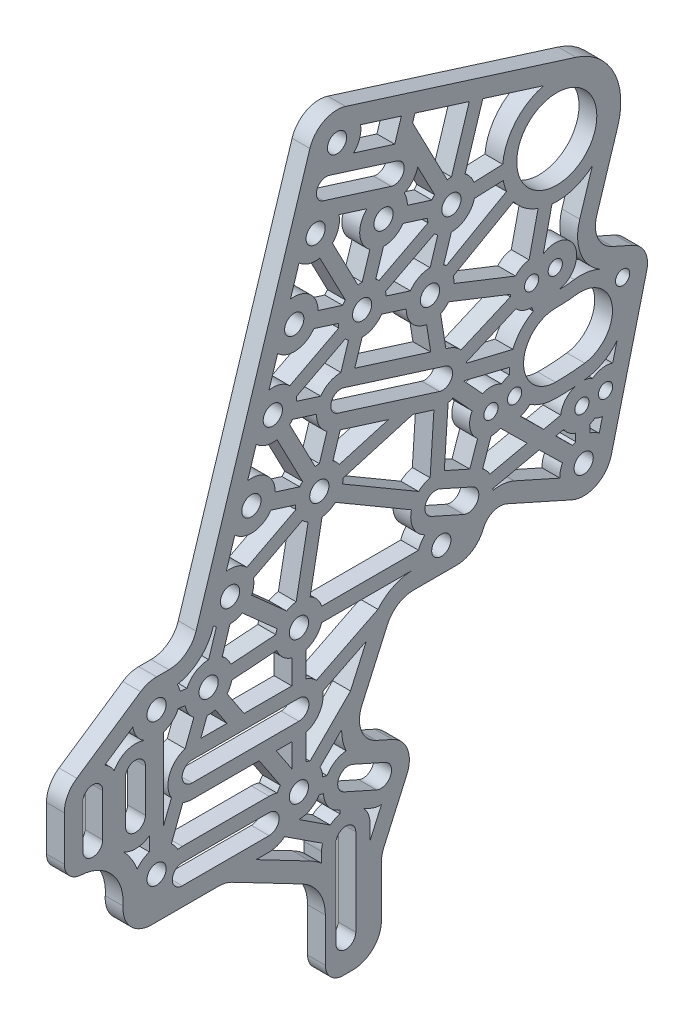
from build123d import *

# Parameters (mm, degrees)
BOSS_EXTRUDE1_DEPTH      = 3.175
BOSS_EXTRUDE1_DEPTH_BACK = 3.175
SKETCH2_R                = 14.2875
SKETCH2_R_2              = 3.429
SKETCH2_R_3              = 2.54
CUT_EXTRUDE2_DEPTH       = 287.611673302


with BuildPart() as part:
    # Sketch2 → Boss-Extrude1 (new, two sides: drawn at the far end of the back side and taken through both)
    with BuildSketch(Plane(origin=(0, 0, 0), x_dir=(0, 0, -1), z_dir=(1, 0, 0)).offset(-BOSS_EXTRUDE1_DEPTH_BACK)):
        with BuildLine():
            Line((38.021448917, 246.234864084), (120.241230069, 220.311066665))
            ThreePointArc((120.241230069, 220.311066665), (133.644163138, 209.06467047), (135.169064986, 191.634962595))
            Line((135.169064986, 191.634962595), (127.622152065, 167.6992128))
            ThreePointArc((127.622152065, 167.6992128), (128.044603019, 160.47960856), (133.162508812, 155.36999111))
            Line((133.162508812, 155.36999111), (140.48887895, 152.092017357))
            ThreePointArc((140.48887895, 152.092017357), (144.852236282, 147.866521475), (145.483799346, 141.825426314))
            Line((145.483799346, 141.825426314), (132.821367632, 91.06703794))
            ThreePointArc((132.821367632, 91.06703794), (127.408392323, 84.390132513), (118.814072234, 84.252183312))
            Line((118.814072234, 84.252183312), (95.644233558, 94.61886171))
            ThreePointArc((95.644233558, 94.61886171), (90.786060122, 94.754966448), (87.254572158, 91.415959651))
            Line((87.254572158, 91.415959651), (86.910445683, 90.646826606))
            ThreePointArc((86.910445683, 90.646826606), (83.162135594, 86.27028604), (77.636394916, 84.636234079))
            Line((77.636394916, 84.636234079), (62.21871433, 84.636234079))
            ThreePointArc((62.21871433, 84.636234079), (56.692973652, 83.002182118), (52.944663563, 78.625641552))
            Line((52.944663563, 78.625641552), (43.839685496, 58.275741142))
            ThreePointArc((43.839685496, 58.275741142), (43.621917914, 50.502663645), (48.96432879, 44.852282903))
            Line((48.96432879, 44.852282903), (54.760610519, 42.258903232))
            ThreePointArc((54.760610519, 42.258903232), (60.103021394, 36.60852249), (59.885253813, 28.835444993))
            Line((59.885253813, 28.835444993), (51.685949233, 10.509752126))
            ThreePointArc((51.685949233, 10.509752126), (51.023955621, 8.481811623), (50.8, 6.360344653))
            Line((50.8, 6.360344653), (50.8, -11.7475))
            ThreePointArc((50.8, -11.7475), (47.824204897, -18.931704897), (40.64, -21.9075))
            Line((40.64, -21.9075), (37.1475, -21.9075))
            ThreePointArc((37.1475, -21.9075), (32.657371939, -20.047628061), (30.7975, -15.5575))
            Line((30.7975, -15.5575), (30.7975, 0))
            ThreePointArc((30.7975, 0), (28.552596998, 8.032774411), (22.468409419, 13.737834946))
            Line((22.468409419, 13.737834946), (-2.554479623, 26.788416358))
            ThreePointArc((-2.554479623, 26.788416358), (-4.834094275, 27.647905305), (-7.252780881, 27.94))
            Line((-7.252780881, 27.94), (-31.256978796, 27.94))
            ThreePointArc((-31.256978796, 27.94), (-38.707276299, 31.19213006), (-41.38801938, 38.866561592))
            ThreePointArc((-41.38801938, 38.866561592), (-45.28789684, 50.537792221), (-56.355984579, 55.915905494))
            ThreePointArc((-56.355984579, 55.915905494), (-60.621662669, 57.889989399), (-62.361270294, 62.25654206))
            Line((-62.361270294, 62.25654206), (-62.361270294, 78.164314079))
            ThreePointArc((-62.361270294, 78.164314079), (-61.17251471, 82.933210558), (-57.884425091, 86.586151856))
            Line((-57.884425091, 86.586151856), (-35.119675091, 101.948071856))
            ThreePointArc((-35.119675091, 101.948071856), (-32.408029017, 103.24198088), (-29.436520294, 103.686234079))
            Line((-29.436520294, 103.686234079), (-25.026637608, 103.686234079))
            ThreePointArc((-25.026637608, 103.686234079), (-19.01893158, 105.6527569), (-15.336873388, 110.791063156))
            Line((-15.336873388, 110.791063156), (25.276513775, 239.600270788))
            ThreePointArc((25.276513775, 239.600270788), (30.274912084, 245.55712993), (38.021448917, 246.234864084))
        make_face()
        with Locations((113.367095492, 198.509097171)):
            Circle(SKETCH2_R, mode=Mode.SUBTRACT)
        with Locations((-29.436520294, 42.726234079)):
            Circle(SKETCH2_R_2, mode=Mode.SUBTRACT)
        with Locations((21.363479706, 93.526234079)):
            Circle(SKETCH2_R_2, mode=Mode.SUBTRACT)
        with Locations((122.963479706, 93.526234079)):
            Circle(SKETCH2_R_2, mode=Mode.SUBTRACT)
        with Locations((104.398969727, 158.50014909)):
            Circle(SKETCH2_R_3, mode=Mode.SUBTRACT)
        with Locations((136.858147411, 143.977222936)):
            Circle(SKETCH2_R_3, mode=Mode.SUBTRACT)
        with Locations((122.335221257, 111.518045252)):
            Circle(SKETCH2_R_3, mode=Mode.SUBTRACT)
        with Locations((89.876043573, 126.040971407)):
            Circle(SKETCH2_R_3, mode=Mode.SUBTRACT)
        with Locations((112.840572264, 159.063757816)):
            Circle(SKETCH2_R_3, mode=Mode.SUBTRACT)
        with Locations((130.776823793, 112.081653978)):
            Circle(SKETCH2_R_3, mode=Mode.SUBTRACT)
        with Locations((98.317646109, 126.604580132)):
            Circle(SKETCH2_R_3, mode=Mode.SUBTRACT)
        with Locations((-29.436520294, 93.526234079)):
            Circle(SKETCH2_R_2, mode=Mode.SUBTRACT)
        with Locations((21.363479706, 42.726234079)):
            Circle(SKETCH2_R_2, mode=Mode.SUBTRACT)
        with Locations((72.163479706, 93.526234079)):
            Circle(SKETCH2_R_2, mode=Mode.SUBTRACT)
        with Locations((34.966277994, 236.545099865)):
            Circle(SKETCH2_R_2, mode=Mode.SUBTRACT)
        with Locations((27.328350687, 212.320689316)):
            Circle(SKETCH2_R_2, mode=Mode.SUBTRACT)
        with Locations((19.690423379, 188.096278767)):
            Circle(SKETCH2_R_2, mode=Mode.SUBTRACT)
        with Locations((12.052496072, 163.871868218)):
            Circle(SKETCH2_R_2, mode=Mode.SUBTRACT)
        with Locations((4.414568765, 139.647457669)):
            Circle(SKETCH2_R_2, mode=Mode.SUBTRACT)
        with Locations((-3.223358543, 115.42304712)):
            Circle(SKETCH2_R_2, mode=Mode.SUBTRACT)
        with Locations((-10.86128585, 91.198636571)):
            Circle(SKETCH2_R_2, mode=Mode.SUBTRACT)
        with Locations((51.552761236, 204.682762008)):
            Circle(SKETCH2_R_2, mode=Mode.SUBTRACT)
        with Locations((43.914833928, 180.458351459)):
            Circle(SKETCH2_R_2, mode=Mode.SUBTRACT)
        with Locations((75.777171785, 197.044834701)):
            Circle(SKETCH2_R_2, mode=Mode.SUBTRACT)
        with Locations((68.139244477, 172.820424152)):
            Circle(SKETCH2_R_2, mode=Mode.SUBTRACT)
        with Locations((28.638979314, 132.009530361)):
            Circle(SKETCH2_R_2, mode=Mode.SUBTRACT)
        with BuildLine():
            Line((30.078004517, 221.041477113), (54.302415066, 213.403549806))
            ThreePointArc((54.302415066, 213.403549806), (58.763142366, 215.72565746), (56.441034713, 220.18638476))
            Line((56.441034713, 220.18638476), (32.216624164, 227.824312067))
            ThreePointArc((32.216624164, 227.824312067), (27.755896864, 225.502204413), (30.078004517, 221.041477113))
        make_face(mode=Mode.SUBTRACT)
        with BuildLine():
            Line((41.656, 20.2565), (41.656, -10.7315))
            ThreePointArc((41.656, -10.7315), (38.1, -14.2875), (34.544, -10.7315))
            Line((34.544, -10.7315), (34.544, 20.2565))
            ThreePointArc((34.544, 20.2565), (38.1, 23.8125), (41.656, 20.2565))
        make_face(mode=Mode.SUBTRACT)
        with BuildLine():
            Line((-20.2565, 41.656), (10.7315, 41.656))
            ThreePointArc((10.7315, 41.656), (14.2875, 38.1), (10.7315, 34.544))
            Line((10.7315, 34.544), (-20.2565, 34.544))
            ThreePointArc((-20.2565, 34.544), (-23.8125, 38.1), (-20.2565, 41.656))
        make_face(mode=Mode.SUBTRACT)
        with BuildLine():
            Line((-48.645270294, 78.164314079), (-48.645270294, 62.924314079))
            ThreePointArc((-48.645270294, 62.924314079), (-52.201270294, 59.368314079), (-55.757270294, 62.924314079))
            Line((-55.757270294, 62.924314079), (-55.757270294, 78.164314079))
            ThreePointArc((-55.757270294, 78.164314079), (-52.201270294, 81.720314079), (-48.645270294, 78.164314079))
        make_face(mode=Mode.SUBTRACT)
        with BuildLine():
            Line((-33.405270294, 78.164314079), (-33.405270294, 62.924314079))
            ThreePointArc((-33.405270294, 62.924314079), (-36.961270294, 59.368314079), (-40.517270294, 62.924314079))
            Line((-40.517270294, 62.924314079), (-40.517270294, 78.164314079))
            ThreePointArc((-40.517270294, 78.164314079), (-36.961270294, 81.720314079), (-33.405270294, 78.164314079))
        make_face(mode=Mode.SUBTRACT)
        with BuildLine():
            Line((37.346216444, 159.625358387), (73.682832268, 148.168467426))
            ThreePointArc((73.682832268, 148.168467426), (76.004939921, 143.707740126), (71.544212621, 141.385632472))
            Line((71.544212621, 141.385632472), (35.207596798, 152.842523433))
            ThreePointArc((35.207596798, 152.842523433), (32.885489144, 157.303250733), (37.346216444, 159.625358387))
        make_face(mode=Mode.SUBTRACT)
        with BuildLine():
            Line((-16.736520294, 71.682234079), (21.363479706, 71.682234079))
            ThreePointArc((21.363479706, 71.682234079), (24.919479706, 68.126234079), (21.363479706, 64.570234079))
            Line((21.363479706, 64.570234079), (-16.736520294, 64.570234079))
            ThreePointArc((-16.736520294, 64.570234079), (-20.292520294, 68.126234079), (-16.736520294, 71.682234079))
        make_face(mode=Mode.SUBTRACT)
        with BuildLine():
            Line((71.695223435, 111.204761595), (83.287786894, 106.018002254))
            ThreePointArc((83.287786894, 106.018002254), (85.209528129, 100.984205414), (80.175731289, 99.062464179))
            Line((80.175731289, 99.062464179), (68.583167831, 104.24922352))
            ThreePointArc((68.583167831, 104.24922352), (66.661426596, 109.28302036), (71.695223435, 111.204761595))
        make_face(mode=Mode.SUBTRACT)
        with BuildLine():
            Line((40.57466739, 41.649380844), (52.167230848, 36.462621503))
            ThreePointArc((52.167230848, 36.462621503), (54.088972084, 31.428824663), (49.055175244, 29.507083428))
            Line((49.055175244, 29.507083428), (37.462611785, 34.693842769))
            ThreePointArc((37.462611785, 34.693842769), (35.54087055, 39.727639609), (40.57466739, 41.649380844))
        make_face(mode=Mode.SUBTRACT)
        with BuildLine():
            ThreePointArc((112.879749334, 123.580682042), (118.115569936, 123.729709032), (123.328186485, 124.244155468))
            ThreePointArc((123.328186485, 124.244155468), (133.137248458, 137.092194354), (120.289209572, 146.901256326))
            ThreePointArc((120.289209572, 146.901256326), (116.666882818, 146.543759651), (113.028431213, 146.440198522))
            ThreePointArc((113.028431213, 146.440198522), (101.524332034, 135.084781222), (112.879749334, 123.580682042))
        make_face(mode=Mode.SUBTRACT)
    extrude(amount=BOSS_EXTRUDE1_DEPTH + BOSS_EXTRUDE1_DEPTH_BACK)

    # Sketch5 → Cut-Extrude2 (cut, through all)
    with BuildSketch(Plane(origin=(3.175, 0, 0), x_dir=(0, 0, -1), z_dir=(1, 0, 0))):
        with BuildLine():
            Line((46.980471507, 24.870058045), (44.610545612, 25.930413273))
            ThreePointArc((44.610545612, 25.930413273), (46.187198771, 23.285973889), (46.736, 20.2565))
            Line((46.736, 20.2565), (46.736, 14.994710434))
            Line((46.736, 14.994710434), (50.808577445, 24.097043773))
            ThreePointArc((50.808577445, 24.097043773), (48.851551638, 24.270741672), (46.980471507, 24.870058045))
        make_face()
        with BuildLine():
            Line((35.986021875, 28.629766536), (36.044141581, 29.763204552))
            Line((36.044141581, 29.763204552), (35.387908049, 30.056817385))
            ThreePointArc((35.387908049, 30.056817385), (31.649849739, 33.198379843), (30.134816405, 37.840272624))
            Line((30.134816405, 37.840272624), (28.592588743, 38.238131636))
            ThreePointArc((28.592588743, 38.238131636), (25.488216552, 35.283813307), (21.33760019, 34.217273435))
            Line((21.33760019, 34.217273435), (32.572923598, 26.892155389))
            ThreePointArc((32.572923598, 26.892155389), (34.181932658, 27.952553814), (35.986021875, 28.629766536))
        make_face()
        with BuildLine():
            ThreePointArc((29.464, 20.2565), (29.548030231, 21.458294107), (29.798485659, 22.636700757))
            Line((29.798485659, 22.636700757), (16.258576402, 31.464344611))
            ThreePointArc((16.258576402, 31.464344611), (13.670460366, 29.97946997), (10.7315, 29.464))
            Line((10.7315, 29.464), (6.047188582, 29.464))
            Line((6.047188582, 29.464), (25.404847706, 19.36809517))
            ThreePointArc((25.404847706, 19.36809517), (27.511291053, 18.114363737), (29.464, 16.632515617))
            Line((29.464, 16.632515617), (29.464, 20.2565))
        make_face()
        with BuildLine():
            Line((29.861564707, 43.157084777), (31.403792369, 42.759225765))
            ThreePointArc((31.403792369, 42.759225765), (34.297317737, 45.704288621), (38.209152197, 47.024680775))
            ThreePointArc((38.209152197, 47.024680775), (36.982995174, 50.607911874), (36.605628355, 54.376280279))
            Line((36.605628355, 54.376280279), (28.901981671, 46.672633595))
            ThreePointArc((28.901981671, 46.672633595), (29.572182481, 44.96683216), (29.861564707, 43.157084777))
        make_face()
        with BuildLine():
            ThreePointArc((10.7315, 46.736), (12.19395928, 46.611269521), (13.614173714, 46.240681068))
            ThreePointArc((13.614173714, 46.240681068), (14.124354661, 47.198163146), (14.752222027, 48.082945094))
            Line((14.752222027, 48.082945094), (7.168582796, 59.490234079))
            Line((7.168582796, 59.490234079), (-16.736520294, 59.490234079))
            ThreePointArc((-16.736520294, 59.490234079), (-18.420834539, 59.656075785), (-20.040459218, 60.147231411))
            Line((-20.040459218, 60.147231411), (-24.158690988, 49.40063284))
            ThreePointArc((-24.158690988, 49.40063284), (-22.854153921, 48.118407475), (-21.853803684, 46.586996933))
            ThreePointArc((-21.853803684, 46.586996933), (-21.05861922, 46.698668546), (-20.2565, 46.736))
            Line((-20.2565, 46.736), (10.7315, 46.736))
        make_face()
        with BuildLine():
            ThreePointArc((23.903479706, 50.847285797), (24.619733032, 50.587525021), (25.309879222, 50.264736043))
            Line((25.309879222, 50.264736043), (39.76736151, 64.722218331))
            Line((39.76736151, 64.722218331), (45.396168809, 77.302772299))
            Line((45.396168809, 77.302772299), (29.882024862, 69.545700326))
            ThreePointArc((29.882024862, 69.545700326), (28.709700087, 63.586020195), (23.903479706, 59.87221106))
            Line((23.903479706, 59.87221106), (23.903479706, 50.847285797))
        make_face()
        Polygon((18.823479706, 59.490234079), (13.268746146, 59.490234079), (18.823479706, 51.134819347), align=None)
        with BuildLine():
            Line((-26.896520294, 56.452599027), (-24.131989673, 63.66669053))
            ThreePointArc((-24.131989673, 63.66669053), (-24.800677172, 71.216520446), (-19.257791302, 76.385997302))
            Line((-19.257791302, 76.385997302), (-16.139115156, 84.52423781))
            ThreePointArc((-16.139115156, 84.52423781), (-18.159117025, 86.823166179), (-19.235130252, 89.688070144))
            Line((-19.235130252, 89.688070144), (-21.694293456, 89.996219264))
            ThreePointArc((-21.694293456, 89.996219264), (-23.806204837, 87.146372885), (-26.896520294, 85.405182362))
            Line((-26.896520294, 85.405182362), (-26.896520294, 56.452599027))
        make_face()
        with BuildLine():
            ThreePointArc((23.903479706, 76.380257098), (25.903693591, 75.47245446), (27.610179797, 74.089390456))
            Line((27.610179797, 74.089390456), (49.544412356, 85.056506735))
            ThreePointArc((49.544412356, 85.056506735), (54.835217868, 89.243227003), (61.359077389, 90.963839252))
            Line((61.359077389, 90.963839252), (61.403867044, 90.986234079))
            Line((61.403867044, 90.986234079), (29.484531424, 90.986234079))
            ThreePointArc((29.484531424, 90.986234079), (27.380251308, 87.509462478), (23.903479706, 85.405182362))
            Line((23.903479706, 85.405182362), (23.903479706, 76.380257098))
        make_face()
        with BuildLine():
            ThreePointArc((-41.056757684, 55.3211911), (-38.311830997, 51.74832385), (-36.343886064, 47.695276152))
            ThreePointArc((-36.343886064, 47.695276152), (-34.416176025, 49.625952175), (-31.976520294, 50.847285797))
            Line((-31.976520294, 50.847285797), (-31.976520294, 55.872168063))
            ThreePointArc((-31.976520294, 55.872168063), (-36.438211119, 54.304168773), (-41.056757684, 55.3211911))
        make_face()
        with BuildLine():
            ThreePointArc((-8.480472262, 83.02949906), (-9.923958236, 82.741420838), (-11.395493462, 82.706422299))
            Line((-11.395493462, 82.706422299), (-13.67338117, 76.762234079))
            Line((-13.67338117, 76.762234079), (-4.313954114, 76.762234079))
            Line((-4.313954114, 76.762234079), (-8.480472262, 83.02949906))
        make_face()
        with BuildLine():
            Line((18.823479706, 76.762234079), (18.823479706, 85.405182362))
            ThreePointArc((18.823479706, 85.405182362), (15.567490172, 87.29650003), (13.446517662, 90.407774044))
            Line((13.446517662, 90.407774044), (-2.57834842, 89.250296628))
            ThreePointArc((-2.57834842, 89.250296628), (-3.221684399, 87.451695062), (-4.250028171, 85.841925555))
            Line((-4.250028171, 85.841925555), (1.786209236, 76.762234079))
            Line((1.786209236, 76.762234079), (18.823479706, 76.762234079))
        make_face()
        with BuildLine():
            ThreePointArc((-44.581270294, 82.228314079), (-39.891862095, 86.287867962), (-33.690779706, 86.15708502))
            ThreePointArc((-33.690779706, 86.15708502), (-36.515054508, 88.804218156), (-37.87442427, 92.428574077))
            Line((-37.87442427, 92.428574077), (-47.90821388, 85.657655298))
            ThreePointArc((-47.90821388, 85.657655298), (-46.002857305, 84.177646967), (-44.581270294, 82.228314079))
        make_face()
        with BuildLine():
            Line((-21.062675891, 95.036800506), (-18.603512688, 94.728651386))
            ThreePointArc((-18.603512688, 94.728651386), (-15.455546851, 98.36074847), (-10.841679556, 99.707613982))
            Line((-10.841679556, 99.707613982), (-8.087846947, 108.441655169))
            ThreePointArc((-8.087846947, 108.441655169), (-8.633920987, 108.855787795), (-9.144894922, 109.3125244))
            Line((-9.144894922, 109.3125244), (-9.280770751, 108.881581329))
            ThreePointArc((-9.280770751, 108.881581329), (-14.071267481, 101.494717355), (-21.977183619, 97.620300196))
            ThreePointArc((-21.977183619, 97.620300196), (-21.415234647, 96.365610346), (-21.062675891, 95.036800506))
        make_face()
        with BuildLine():
            Line((-2.944323806, 94.317096606), (13.080542277, 95.474574022))
            ThreePointArc((13.080542277, 95.474574022), (13.307404676, 96.265346364), (13.609571198, 97.030514867))
            Line((13.609571198, 97.030514867), (1.151976401, 108.125134738))
            ThreePointArc((1.151976401, 108.125134738), (-0.962880133, 107.219796645), (-3.242964838, 106.914069708))
            Line((-3.242964838, 106.914069708), (-5.996797446, 98.180028521))
            ThreePointArc((-5.996797446, 98.180028521), (-4.185064641, 96.47416037), (-2.944323806, 94.317096606))
        make_face()
        with BuildLine():
            ThreePointArc((25.367878871, 101.034087856), (27.915313996, 98.955465004), (29.484531424, 96.066234079))
            Line((29.484531424, 96.066234079), (64.042427989, 96.066234079))
            ThreePointArc((64.042427989, 96.066234079), (64.944109342, 98.02998502), (66.311375101, 99.703284563))
            ThreePointArc((66.311375101, 99.703284563), (62.107372078, 103.916230117), (61.503269409, 109.837176969))
            Line((61.503269409, 109.837176969), (34.365569691, 125.715942859))
            ThreePointArc((34.365569691, 125.715942859), (32.165006342, 124.26548656), (29.62615835, 123.557988576))
            Line((29.62615835, 123.557988576), (25.367878871, 101.034087856))
        make_face()
        with BuildLine():
            ThreePointArc((90.598634401, 101.899435076), (90.570193431, 101.584106435), (90.530542158, 101.269990506))
            ThreePointArc((90.530542158, 101.269990506), (94.450916955, 101.445171767), (98.237613228, 100.415143439))
            Line((98.237613228, 100.415143439), (114.462548475, 93.155762479))
            ThreePointArc((114.462548475, 93.155762479), (114.650376235, 95.341555449), (115.39081472, 97.406675548))
            Line((115.39081472, 97.406675548), (107.104937165, 105.54913576))
            Line((107.104937165, 105.54913576), (90.598634401, 101.899435076))
        make_face()
        with BuildLine():
            Line((4.530549966, 111.918766332), (16.988144763, 100.824146461))
            ThreePointArc((16.988144763, 100.824146461), (18.6208798, 101.581122455), (20.37630067, 101.977775864))
            Line((20.37630067, 101.977775864), (24.634580149, 124.501676585))
            ThreePointArc((24.634580149, 124.501676585), (23.56535863, 125.178611377), (22.608359941, 126.006638476))
            Line((22.608359941, 126.006638476), (5.152943785, 116.919923972))
            ThreePointArc((5.152943785, 116.919923972), (5.220504308, 114.372208808), (4.530549966, 111.918766332))
        make_face()
        with BuildLine():
            Line((-1.506967615, 133.536934949), (-4.569145328, 123.824948031))
            ThreePointArc((-4.569145328, 123.824948031), (-0.591681288, 123.514855065), (2.80726083, 121.425939005))
            Line((2.80726083, 121.425939005), (20.262676986, 130.512653509))
            ThreePointArc((20.262676986, 130.512653509), (20.162358627, 131.267922146), (20.130001902, 132.029136656))
            Line((20.130001902, 132.029136656), (11.395960715, 134.782969264))
            ThreePointArc((11.395960715, 134.782969264), (5.232476972, 131.177858672), (-1.506967615, 133.536934949))
        make_face()
        with BuildLine():
            Line((36.931071717, 130.100529425), (64.068771435, 114.221763535))
            ThreePointArc((64.068771435, 114.221763535), (65.976106018, 115.581977271), (68.172531738, 116.396729181))
            Line((68.172531738, 116.396729181), (69.528103578, 136.694781256))
            Line((69.528103578, 136.694781256), (62.029295498, 139.059146362))
            Line((62.029295498, 139.059146362), (37.146181213, 131.834610837))
            ThreePointArc((37.146181213, 131.834610837), (37.083257368, 130.962033753), (36.931071717, 130.100529425))
        make_face()
        with BuildLine():
            Line((6.130959692, 157.761345498), (3.068781979, 148.04935858))
            ThreePointArc((3.068781979, 148.04935858), (9.942522355, 146.116214126), (12.923546176, 139.627851374))
            Line((12.923546176, 139.627851374), (21.657587363, 136.874018766))
            ThreePointArc((21.657587363, 136.874018766), (22.120707147, 137.479010132), (22.636087429, 138.040149734))
            Line((22.636087429, 138.040149734), (13.549372924, 155.49556589))
            ThreePointArc((13.549372924, 155.49556589), (9.56696951, 155.733979136), (6.130959692, 157.761345498))
        make_face()
        with BuildLine():
            Line((113.021448781, 106.857332804), (118.951422885, 101.029998539))
            ThreePointArc((118.951422885, 101.029998539), (119.536502775, 101.314617102), (120.141619508, 101.553698562))
            Line((120.141619508, 101.553698562), (120.047481812, 104.249575796))
            ThreePointArc((120.047481812, 104.249575796), (117.668440455, 105.494295843), (115.86881775, 107.486913191))
            Line((115.86881775, 107.486913191), (113.021448781, 106.857332804))
        make_face()
        with BuildLine():
            ThreePointArc((125.218525199, 101.730979708), (126.956612612, 101.040085994), (128.501764798, 99.986147333))
            Line((128.501764798, 99.986147333), (129.639537548, 104.547002029))
            ThreePointArc((129.639537548, 104.547002029), (128.265560542, 104.887353672), (126.978240727, 105.475961986))
            ThreePointArc((126.978240727, 105.475961986), (126.088153641, 104.886311051), (125.124387503, 104.426856942))
            Line((125.124387503, 104.426856942), (125.218525199, 101.730979708))
        make_face()
        with BuildLine():
            Line((74.597870978, 136.372119438), (73.241241053, 116.058223812))
            ThreePointArc((73.241241053, 116.058223812), (73.507323098, 115.954253182), (73.769927172, 115.841786978))
            Line((73.769927172, 115.841786978), (82.326518698, 112.013386023))
            Line((82.326518698, 112.013386023), (85.123618959, 120.084558032))
            ThreePointArc((85.123618959, 120.084558032), (82.416286232, 124.486487436), (83.140057613, 129.603399392))
            Line((83.140057613, 129.603399392), (76.338399636, 136.985658167))
            ThreePointArc((76.338399636, 136.985658167), (75.484571388, 136.632261802), (74.597870978, 136.372119438))
        make_face()
        with BuildLine():
            Line((13.768887, 181.985756047), (10.706709287, 172.273769129))
            ThreePointArc((10.706709287, 172.273769129), (14.684173326, 171.963676163), (18.083115445, 169.874760103))
            Line((18.083115445, 169.874760103), (35.5385316, 178.961474607))
            ThreePointArc((35.5385316, 178.961474607), (35.438213242, 179.716743244), (35.405856517, 180.477957754))
            Line((35.405856517, 180.477957754), (26.67181533, 183.231790362))
            ThreePointArc((26.67181533, 183.231790362), (20.508331587, 179.62667977), (13.768887, 181.985756047))
        make_face()
        with BuildLine():
            Line((35.729752089, 136.713148378), (53.295060062, 141.813040216))
            Line((53.295060062, 141.813040216), (36.102452391, 147.233848593))
            Line((36.102452391, 147.233848593), (33.503467718, 138.990922311))
            ThreePointArc((33.503467718, 138.990922311), (34.724135926, 137.957130718), (35.729752089, 136.713148378))
        make_face()
        with BuildLine():
            ThreePointArc((126.133804322, 118.123737244), (129.57762972, 119.606701059), (133.311815604, 119.267627574))
            Line((133.311815604, 119.267627574), (134.855400535, 125.455213436))
            ThreePointArc((134.855400535, 125.455213436), (130.044534941, 121.263579776), (124.003514688, 119.209244166))
            ThreePointArc((124.003514688, 119.209244166), (123.565842117, 119.151768163), (123.127859103, 119.096707749))
            ThreePointArc((123.127859103, 119.096707749), (124.681813523, 118.76772833), (126.133804322, 118.123737244))
        make_face()
        with BuildLine():
            ThreePointArc((19.033888022, 159.007379813), (18.570768238, 158.402388447), (18.055387957, 157.841248845))
            Line((18.055387957, 157.841248845), (27.142102461, 140.385832689))
            ThreePointArc((27.142102461, 140.385832689), (27.897371099, 140.486151047), (28.658585608, 140.518507773))
            Line((28.658585608, 140.518507773), (31.372432975, 149.125731976))
            ThreePointArc((31.372432975, 149.125731976), (28.616681066, 152.246279886), (27.641112225, 156.293532446))
            Line((27.641112225, 156.293532446), (19.033888022, 159.007379813))
        make_face()
        with BuildLine():
            Line((108.69955677, 111.104418706), (114.772071137, 112.447109443))
            ThreePointArc((114.772071137, 112.447109443), (116.466475017, 116.378314542), (120.013080821, 118.775597442))
            ThreePointArc((120.013080821, 118.775597442), (116.432975443, 118.557859031), (112.846708917, 118.500789491))
            ThreePointArc((112.846708917, 118.500789491), (108.106591462, 119.228112974), (103.775459791, 121.286998933))
            ThreePointArc((103.775459791, 121.286998933), (102.21464382, 120.056465225), (100.388699082, 119.271426678))
            Line((100.388699082, 119.271426678), (108.69955677, 111.104418706))
        make_face()
        with BuildLine():
            Line((21.406814307, 206.210166596), (18.344636594, 196.498179678))
            ThreePointArc((18.344636594, 196.498179678), (25.21837697, 194.565035224), (28.199400791, 188.076672472))
            Line((28.199400791, 188.076672472), (36.933441978, 185.322839864))
            ThreePointArc((36.933441978, 185.322839864), (37.396561762, 185.92783123), (37.911942043, 186.488970832))
            Line((37.911942043, 186.488970832), (28.825227539, 203.944386988))
            ThreePointArc((28.825227539, 203.944386988), (24.842824125, 204.182800234), (21.406814307, 206.210166596))
        make_face()
        with BuildLine():
            Line((37.884214556, 174.455459574), (20.4287984, 165.36874507))
            ThreePointArc((20.4287984, 165.36874507), (20.529116758, 164.613476433), (20.561473484, 163.852261923))
            Line((20.561473484, 163.852261923), (29.168697687, 161.138414556))
            ThreePointArc((29.168697687, 161.138414556), (32.289245597, 163.894166466), (36.336498157, 164.869735306))
            Line((36.336498157, 164.869735306), (39.050345524, 173.476959509))
            ThreePointArc((39.050345524, 173.476959509), (38.445354158, 173.940079293), (37.884214556, 174.455459574))
        make_face()
        with BuildLine():
            ThreePointArc((81.19823842, 145.716809287), (81.218331365, 145.510370786), (81.233460761, 145.303509281))
            Line((81.233460761, 145.303509281), (97.696381664, 141.317771571))
            ThreePointArc((97.696381664, 141.317771571), (100.646057999, 146.014641368), (104.984718899, 149.469666399))
            Line((104.984718899, 149.469666399), (104.470887372, 150.880488478))
            ThreePointArc((104.470887372, 150.880488478), (101.382705464, 151.502538792), (98.81003471, 153.320553994))
            Line((98.81003471, 153.320553994), (81.19823842, 145.716809287))
        make_face()
        with BuildLine():
            Line((80.157992931, 140.337123858), (86.876069591, 133.04558104))
            ThreePointArc((86.876069591, 133.04558104), (90.322393143, 133.647887474), (93.674626639, 132.646663399))
            ThreePointArc((93.674626639, 132.646663399), (95.005188813, 133.466943185), (96.475133752, 133.998465999))
            ThreePointArc((96.475133752, 133.998465999), (96.445065712, 135.189906173), (96.501027341, 136.380411138))
            Line((96.501027341, 136.380411138), (80.157992931, 140.337123858))
        make_face()
        with BuildLine():
            ThreePointArc((93.219892003, 119.193849553), (91.615182995, 118.622090489), (89.923553575, 118.421119518))
            Line((89.923553575, 118.421119518), (86.921397594, 109.758249025))
            ThreePointArc((86.921397594, 109.758249025), (88.371743097, 108.451469332), (89.501887787, 106.859631329))
            Line((89.501887787, 106.859631329), (102.783045153, 109.796221661))
            Line((102.783045153, 109.796221661), (93.219892003, 119.193849553))
        make_face()
        with BuildLine():
            ThreePointArc((75.210417729, 153.013349536), (77.382783599, 151.976677998), (79.184644587, 150.380696064))
            Line((79.184644587, 150.380696064), (96.796440876, 157.984440771))
            ThreePointArc((96.796440876, 157.984440771), (96.779910845, 158.380392056), (96.783988591, 158.776667256))
            Line((96.783988591, 158.776667256), (74.75955868, 167.474910064))
            ThreePointArc((74.75955868, 167.474910064), (73.466049449, 166.185047011), (71.927038457, 165.200995186))
            Line((71.927038457, 165.200995186), (73.800639371, 153.457850945))
            Line((73.800639371, 153.457850945), (75.210417729, 153.013349536))
        make_face()
        with BuildLine():
            ThreePointArc((119.613881369, 151.936167628), (124.194192842, 151.909459384), (128.590897362, 150.625342616))
            ThreePointArc((128.590897362, 150.625342616), (121.828084772, 158.914202291), (121.566049428, 169.608694627))
            Line((121.566049428, 169.608694627), (126.068251812, 183.887856308))
            ThreePointArc((126.068251812, 183.887856308), (119.332990064, 180.083350017), (111.646016082, 179.218220003))
            Line((111.646016082, 179.218220003), (108.538052572, 165.352853482))
            ThreePointArc((108.538052572, 165.352853482), (119.939542706, 161.833057125), (113.93325271, 151.522507957))
            ThreePointArc((113.93325271, 151.522507957), (116.77984028, 151.643189808), (119.613881369, 151.936167628))
        make_face()
        with BuildLine():
            Line((45.645070738, 210.806672032), (35.680177923, 213.948590668))
            ThreePointArc((35.680177923, 213.948590668), (35.463319967, 209.825623021), (33.331242572, 206.290069943))
            Line((33.331242572, 206.290069943), (42.417957076, 188.834653787))
            ThreePointArc((42.417957076, 188.834653787), (43.173225713, 188.934972145), (43.934440223, 188.967328871))
            Line((43.934440223, 188.967328871), (46.688272831, 197.701370058))
            ThreePointArc((46.688272831, 197.701370058), (43.070592024, 204.007568358), (45.645070738, 210.806672032))
        make_face()
        with BuildLine():
            ThreePointArc((50.896225879, 175.593863055), (47.843852878, 172.91077628), (43.895227634, 171.949374048))
            Line((43.895227634, 171.949374048), (41.29624296, 163.706447766))
            Line((41.29624296, 163.706447766), (68.383896501, 155.165743411))
            Line((68.383896501, 155.165743411), (66.910487174, 164.400612011))
            ThreePointArc((66.910487174, 164.400612011), (61.69627814, 167.262432989), (59.630267066, 172.840030446))
            Line((59.630267066, 172.840030446), (50.896225879, 175.593863055))
        make_face()
        with BuildLine():
            Line((57.913936584, 233.30462687), (43.368178906, 237.89088665))
            ThreePointArc((43.368178906, 237.89088665), (43.037225534, 233.850125502), (40.873968492, 230.421189841))
            Line((40.873968492, 230.421189841), (55.546179119, 225.7950596))
            Line((55.546179119, 225.7950596), (57.913936584, 233.30462687))
        make_face()
        with BuildLine():
            ThreePointArc((63.741005984, 214.665265434), (61.989469065, 211.24645775), (58.928578059, 208.925450682))
            ThreePointArc((58.928578059, 208.925450682), (59.776109798, 206.868996082), (60.061738648, 204.663155714))
            Line((60.061738648, 204.663155714), (68.795779835, 201.909323105))
            ThreePointArc((68.795779835, 201.909323105), (69.258899618, 202.514314472), (69.7742799, 203.075454074))
            Line((69.7742799, 203.075454074), (63.741005984, 214.665265434))
        make_face()
        with BuildLine():
            ThreePointArc((52.291136256, 181.955228312), (52.391454614, 181.199959674), (52.42381134, 180.438745165))
            Line((52.42381134, 180.438745165), (61.157852527, 177.684912556))
            ThreePointArc((61.157852527, 177.684912556), (64.210225527, 180.367999331), (68.158850772, 181.329401564))
            Line((68.158850772, 181.329401564), (70.91268338, 190.063442751))
            ThreePointArc((70.91268338, 190.063442751), (70.307692014, 190.526562534), (69.746552412, 191.041942816))
            Line((69.746552412, 191.041942816), (52.291136256, 181.955228312))
        make_face()
        with BuildLine():
            Line((76.625579261, 172.199776961), (98.650009172, 163.501534152))
            ThreePointArc((98.650009172, 163.501534152), (100.832465268, 165.233977566), (103.491840681, 166.065961465))
            Line((103.491840681, 166.065961465), (106.689020974, 180.329345331))
            ThreePointArc((106.689020974, 180.329345331), (101.841659033, 182.944253109), (97.926368939, 186.81790306))
            Line((97.926368939, 186.81790306), (76.455200347, 174.62263362))
            ThreePointArc((76.455200347, 174.62263362), (76.627283203, 173.417315765), (76.625579261, 172.199776961))
        make_face()
        with BuildLine():
            Line((82.138347133, 225.666699563), (62.758818694, 231.777041409))
            Line((62.758818694, 231.777041409), (61.929502906, 229.146787765))
            Line((61.929502906, 229.146787765), (74.280294932, 205.421137029))
            ThreePointArc((74.280294932, 205.421137029), (75.03556357, 205.521455387), (75.796778079, 205.553812113))
            Line((75.796778079, 205.553812113), (82.138347133, 225.666699563))
        make_face()
        with BuildLine():
            ThreePointArc((58.534153186, 199.818273604), (55.481780186, 197.135186829), (51.533154941, 196.173784597))
            Line((51.533154941, 196.173784597), (48.779322333, 187.439743409))
            ThreePointArc((48.779322333, 187.439743409), (49.384313699, 186.976623626), (49.945453301, 186.461243344))
            Line((49.945453301, 186.461243344), (67.400869457, 195.547957848))
            ThreePointArc((67.400869457, 195.547957848), (67.300551099, 196.303226486), (67.268194373, 197.064440995))
            Line((67.268194373, 197.064440995), (58.534153186, 199.818273604))
        make_face()
        with BuildLine():
            ThreePointArc((94.08255862, 200.299821576), (98.67129488, 211.123909918), (108.675160128, 217.299674565))
            Line((108.675160128, 217.299674565), (86.983229243, 224.139114101))
            Line((86.983229243, 224.139114101), (80.641660189, 204.026226651))
            ThreePointArc((80.641660189, 204.026226651), (82.539967851, 202.208909678), (83.793201999, 199.899014199))
            Line((83.793201999, 199.899014199), (94.08255862, 200.299821576))
        make_face()
        with BuildLine():
            Line((75.75756549, 188.535857289), (73.003732882, 179.801816102))
            ThreePointArc((73.003732882, 179.801816102), (73.488598009, 179.437636389), (73.946294819, 179.039849152))
            Line((73.946294819, 179.039849152), (95.41746341, 191.235118591))
            ThreePointArc((95.41746341, 191.235118591), (94.741803234, 193.198866993), (94.280292894, 195.223671346))
            Line((94.280292894, 195.223671346), (83.990936273, 194.822863969))
            ThreePointArc((83.990936273, 194.822863969), (80.941246762, 190.282038635), (75.75756549, 188.535857289))
        make_face()
    extrude(amount=-CUT_EXTRUDE2_DEPTH, mode=Mode.SUBTRACT)


solid = part.part
